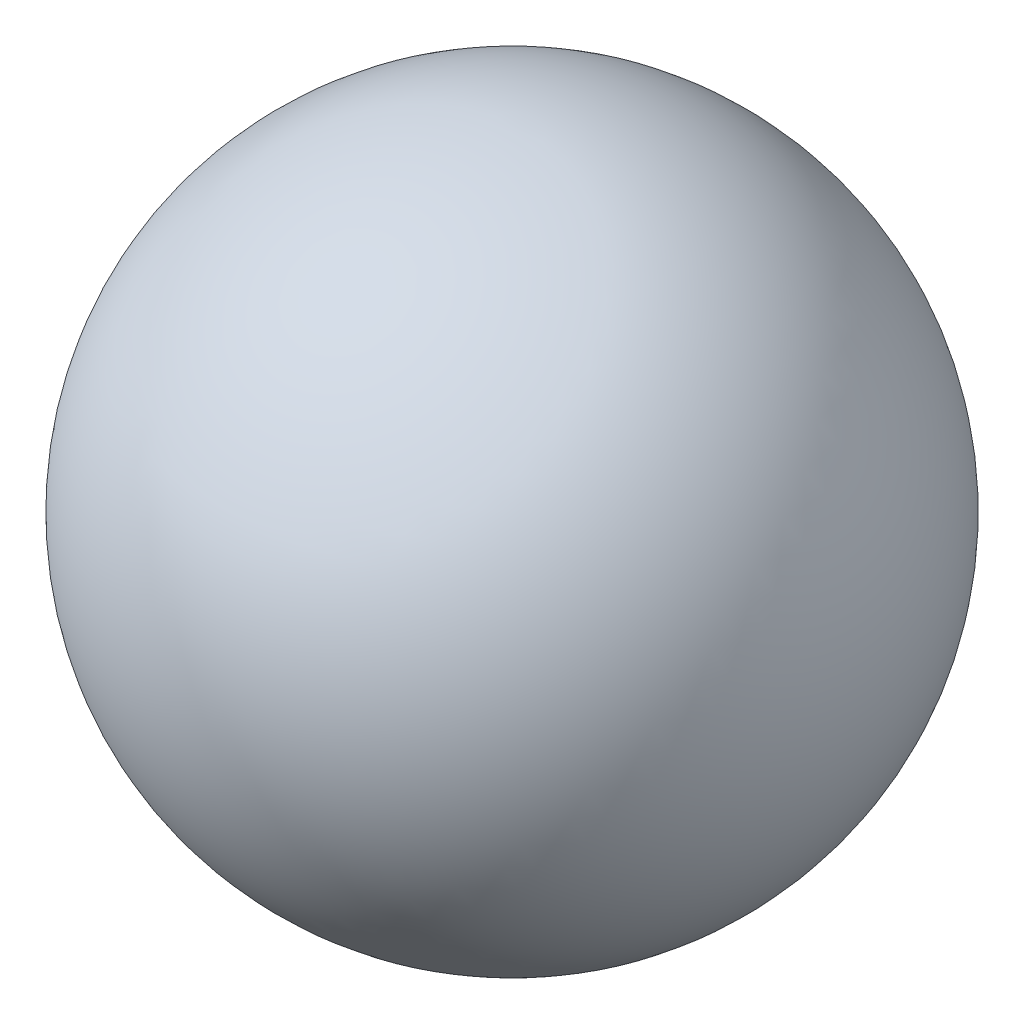
from build123d import *


with BuildPart() as part:
    # Sketch2 → Revolve1 (revolve)
    with BuildSketch(Plane(origin=(0, 0, 0), x_dir=(0, 0, -1), z_dir=(1, 0, 0))):
        with BuildLine():
            Line((0, 2.25), (0, -2.25))
            ThreePointArc((0, -2.25), (2.25, 0), (0, 2.25))
        make_face()
    revolve(axis=Axis((0, -2.25, 0), (0, 1, 0)))


solid = part.part
